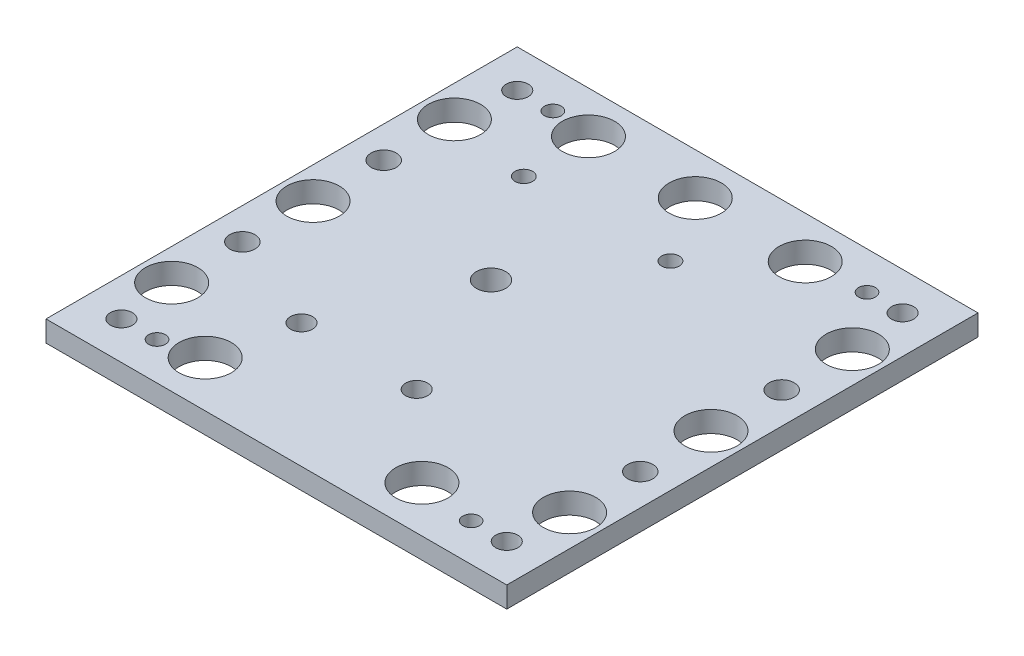
from build123d import *

# Parameters (mm, degrees)
SKETCH1_W                  = 220
SKETCH1_H                  = 225
BOSS_EXTRUDE1_DEPTH        = 10
CUT_EXTRUDE2_REACH         = 159.659
SKETCH3_R                  = 7
F_8_0MM_DOWEL_HOLE1_D      = 8
M10_CLEARANCE_HOLE1_D      = 10.5
M10_CLEARANCE_HOLE2_D      = 10.5
M8_CLEARANCE_HOLE1_D       = 8.4
CUT_EXTRUDE3_REACH         = 159.659
SKETCH17_R                 = 12.5
F_12_0_12_DIAMETER_HOLE1_D = 12


with BuildPart() as part:
    # Sketch1 → Boss-Extrude1 (new body)
    with BuildSketch(Plane(origin=(0, 0, 0), x_dir=(1, 0, 0), z_dir=(0, 1, 0))):
        Rectangle(SKETCH1_W, SKETCH1_H)
    extrude(amount=BOSS_EXTRUDE1_DEPTH)

    # Sketch3 → Cut-Extrude2 (cut, up to next)
    with BuildSketch(Plane.XZ, mode=Mode.PRIVATE) as cut_extrude2_sk1:
        with Locations((-19.87, -9.86)):
            Circle(SKETCH3_R)
    cut_extrude2_tool1 = extrude(cut_extrude2_sk1.sketch, amount=-CUT_EXTRUDE2_REACH, mode=Mode.PRIVATE) & part.part
    add(cut_extrude2_tool1.solids().sort_by_distance((-19.87, 0, -9.86))[0], mode=Mode.SUBTRACT)

    # Ø8.0mm Dowel Hole1 (through all)
    with Locations(Plane(origin=(0, 10, 0), x_dir=(1, 0, 0), z_dir=(0, 1, 0))):
        with Locations((75, -94.5), (-75, -94.5), (75, 94.5), (-75, 94.5)):
            Hole(F_8_0MM_DOWEL_HOLE1_D / 2)

    # M10 Clearance Hole1 (through all)
    with Locations(Plane(origin=(0, 10, 0), x_dir=(1, 0, 0), z_dir=(0, 1, 0))):
        with Locations((92, -94.5), (92, 94.5), (-92, 94.5), (-92, -94.5)):
            Hole(M10_CLEARANCE_HOLE1_D / 2)

    # M10 Clearance Hole2 (through all)
    with Locations(Plane(origin=(0, 10, 0), x_dir=(1, 0, 0), z_dir=(0, 1, 0))):
        with Locations((7.63, -53.14), (-47.37, -53.14)):
            Hole(M10_CLEARANCE_HOLE2_D / 2)

    # M8 Clearance Hole1 (through all)
    with Locations(Plane(origin=(0, 10, 0), x_dir=(1, 0, 0), z_dir=(0, 1, 0))):
        with Locations((15.13, 60.5), (-54.87, 60.5)):
            Hole(M8_CLEARANCE_HOLE1_D / 2)

    # Sketch17 → Cut-Extrude3 (cut, up to next)
    with BuildSketch(Plane(origin=(0, 10, 0), x_dir=(1, 0, 0), z_dir=(0, 1, 0)), mode=Mode.PRIVATE) as cut_extrude3_sk1:
        with Locations((-95, -67.5)):
            Circle(SKETCH17_R)
    cut_extrude3_tool1 = extrude(cut_extrude3_sk1.sketch, amount=-CUT_EXTRUDE3_REACH, mode=Mode.PRIVATE) & part.part
    # Sketch17 → Cut-Extrude3 (cut, up to next)
    with BuildSketch(Plane(origin=(0, 10, 0), x_dir=(1, 0, 0), z_dir=(0, 1, 0)), mode=Mode.PRIVATE) as cut_extrude3_sk2:
        with Locations((-95, 0)):
            Circle(SKETCH17_R)
    cut_extrude3_tool2 = extrude(cut_extrude3_sk2.sketch, amount=-CUT_EXTRUDE3_REACH, mode=Mode.PRIVATE) & part.part
    # Sketch17 → Cut-Extrude3 (cut, up to next)
    with BuildSketch(Plane(origin=(0, 10, 0), x_dir=(1, 0, 0), z_dir=(0, 1, 0)), mode=Mode.PRIVATE) as cut_extrude3_sk3:
        with Locations((-95, 67.5)):
            Circle(SKETCH17_R)
    cut_extrude3_tool3 = extrude(cut_extrude3_sk3.sketch, amount=-CUT_EXTRUDE3_REACH, mode=Mode.PRIVATE) & part.part
    # Sketch17 → Cut-Extrude3 (cut, up to next)
    with BuildSketch(Plane(origin=(0, 10, 0), x_dir=(1, 0, 0), z_dir=(0, 1, 0)), mode=Mode.PRIVATE) as cut_extrude3_sk4:
        with Locations((-56, -90.5)):
            Circle(SKETCH17_R)
    cut_extrude3_tool4 = extrude(cut_extrude3_sk4.sketch, amount=-CUT_EXTRUDE3_REACH, mode=Mode.PRIVATE) & part.part
    # Sketch17 → Cut-Extrude3 (cut, up to next)
    with BuildSketch(Plane(origin=(0, 10, 0), x_dir=(1, 0, 0), z_dir=(0, 1, 0)), mode=Mode.PRIVATE) as cut_extrude3_sk5:
        with Locations((47.5, -90.5)):
            Circle(SKETCH17_R)
    cut_extrude3_tool5 = extrude(cut_extrude3_sk5.sketch, amount=-CUT_EXTRUDE3_REACH, mode=Mode.PRIVATE) & part.part
    # Sketch17 → Cut-Extrude3 (cut, up to next)
    with BuildSketch(Plane(origin=(0, 10, 0), x_dir=(1, 0, 0), z_dir=(0, 1, 0)), mode=Mode.PRIVATE) as cut_extrude3_sk6:
        with Locations((95, -67.5)):
            Circle(SKETCH17_R)
    cut_extrude3_tool6 = extrude(cut_extrude3_sk6.sketch, amount=-CUT_EXTRUDE3_REACH, mode=Mode.PRIVATE) & part.part
    # Sketch17 → Cut-Extrude3 (cut, up to next)
    with BuildSketch(Plane(origin=(0, 10, 0), x_dir=(1, 0, 0), z_dir=(0, 1, 0)), mode=Mode.PRIVATE) as cut_extrude3_sk7:
        with Locations((95, 0)):
            Circle(SKETCH17_R)
    cut_extrude3_tool7 = extrude(cut_extrude3_sk7.sketch, amount=-CUT_EXTRUDE3_REACH, mode=Mode.PRIVATE) & part.part
    # Sketch17 → Cut-Extrude3 (cut, up to next)
    with BuildSketch(Plane(origin=(0, 10, 0), x_dir=(1, 0, 0), z_dir=(0, 1, 0)), mode=Mode.PRIVATE) as cut_extrude3_sk8:
        with Locations((95, 67.5)):
            Circle(SKETCH17_R)
    cut_extrude3_tool8 = extrude(cut_extrude3_sk8.sketch, amount=-CUT_EXTRUDE3_REACH, mode=Mode.PRIVATE) & part.part
    # Sketch17 → Cut-Extrude3 (cut, up to next)
    with BuildSketch(Plane(origin=(0, 10, 0), x_dir=(1, 0, 0), z_dir=(0, 1, 0)), mode=Mode.PRIVATE) as cut_extrude3_sk9:
        with Locations((47.5, 92.5)):
            Circle(SKETCH17_R)
    cut_extrude3_tool9 = extrude(cut_extrude3_sk9.sketch, amount=-CUT_EXTRUDE3_REACH, mode=Mode.PRIVATE) & part.part
    # Sketch17 → Cut-Extrude3 (cut, up to next)
    with BuildSketch(Plane(origin=(0, 10, 0), x_dir=(1, 0, 0), z_dir=(0, 1, 0)), mode=Mode.PRIVATE) as cut_extrude3_sk10:
        with Locations((-5, 92.5)):
            Circle(SKETCH17_R)
    cut_extrude3_tool10 = extrude(cut_extrude3_sk10.sketch, amount=-CUT_EXTRUDE3_REACH, mode=Mode.PRIVATE) & part.part
    # Sketch17 → Cut-Extrude3 (cut, up to next)
    with BuildSketch(Plane(origin=(0, 10, 0), x_dir=(1, 0, 0), z_dir=(0, 1, 0)), mode=Mode.PRIVATE) as cut_extrude3_sk11:
        with Locations((-56, 92.5)):
            Circle(SKETCH17_R)
    cut_extrude3_tool11 = extrude(cut_extrude3_sk11.sketch, amount=-CUT_EXTRUDE3_REACH, mode=Mode.PRIVATE) & part.part
    add(cut_extrude3_tool1.solids().sort_by_distance((-95, 10, 67.5))[0], mode=Mode.SUBTRACT)
    add(cut_extrude3_tool2.solids().sort_by_distance((-95, 10, 0))[0], mode=Mode.SUBTRACT)
    add(cut_extrude3_tool3.solids().sort_by_distance((-95, 10, -67.5))[0], mode=Mode.SUBTRACT)
    add(cut_extrude3_tool4.solids().sort_by_distance((-56, 10, 90.5))[0], mode=Mode.SUBTRACT)
    add(cut_extrude3_tool5.solids().sort_by_distance((47.5, 10, 90.5))[0], mode=Mode.SUBTRACT)
    add(cut_extrude3_tool6.solids().sort_by_distance((95, 10, 67.5))[0], mode=Mode.SUBTRACT)
    add(cut_extrude3_tool7.solids().sort_by_distance((95, 10, 0))[0], mode=Mode.SUBTRACT)
    add(cut_extrude3_tool8.solids().sort_by_distance((95, 10, -67.5))[0], mode=Mode.SUBTRACT)
    add(cut_extrude3_tool9.solids().sort_by_distance((47.5, 10, -92.5))[0], mode=Mode.SUBTRACT)
    add(cut_extrude3_tool10.solids().sort_by_distance((-5, 10, -92.5))[0], mode=Mode.SUBTRACT)
    add(cut_extrude3_tool11.solids().sort_by_distance((-56, 10, -92.5))[0], mode=Mode.SUBTRACT)

    # Ø12.0 (12) Diameter Hole1 (through all)
    with Locations(Plane(origin=(0, 10, 0), x_dir=(1, 0, 0), z_dir=(0, 1, 0))):
        with Locations((95, -33.75), (-95, -33.75), (-95, 33.75), (95, 33.75)):
            Hole(F_12_0_12_DIAMETER_HOLE1_D / 2)


solid = part.part
